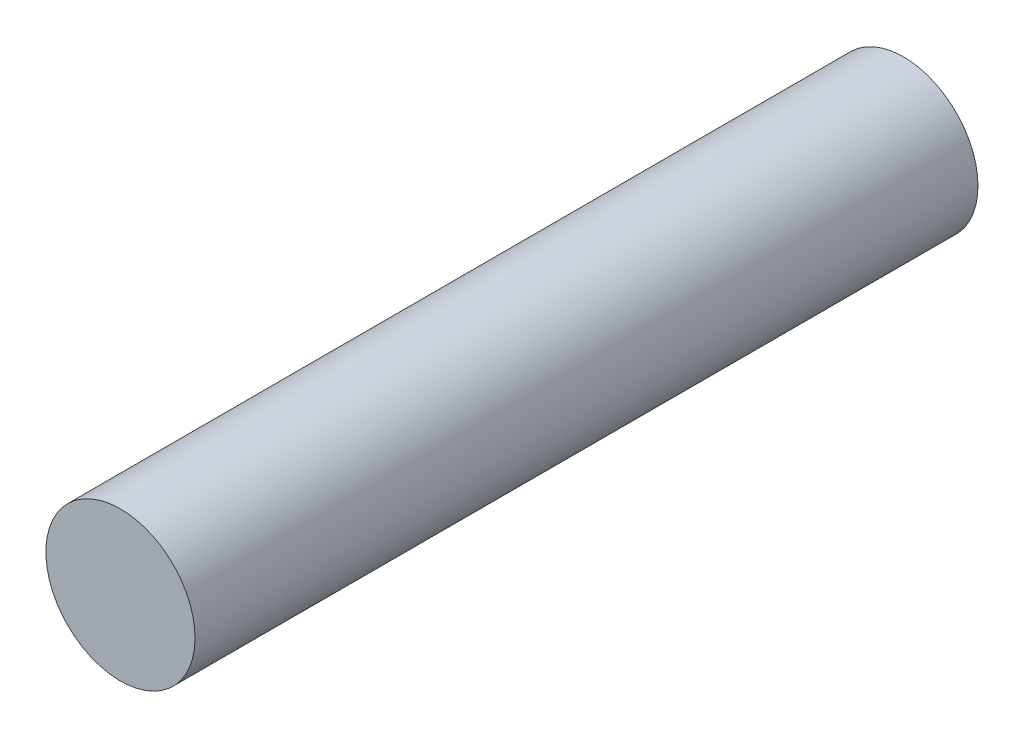
from build123d import *

# Parameters (mm, degrees)
SKETCH1_R           = 4.7625
BOSS_EXTRUDE1_DEPTH = 50


with BuildPart() as part:
    # Sketch1 → Boss-Extrude1 (new body)
    with BuildSketch(Plane.XY):
        Circle(SKETCH1_R)
    extrude(amount=BOSS_EXTRUDE1_DEPTH)


solid = part.part
